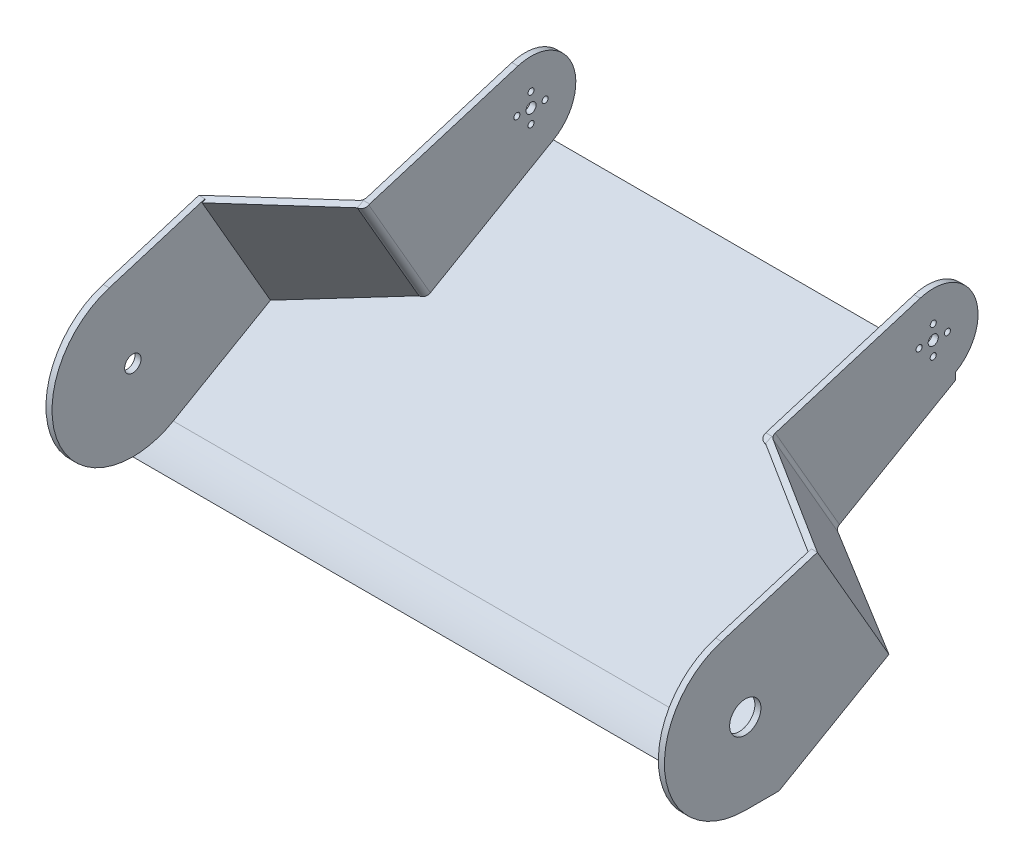
from build123d import *

# Parameters (mm, degrees)
SKETCH_2_R          = 3
SKETCH_2_R_2        = 1.5
SKETCH_2_R_3        = 2.5
EXTRUDE_1_DEPTH     = 3
EXTRUDE_2_DEPTH     = 196
SKETCH_5_R          = 8
CUT_EXTRUDE_1_DEPTH = 10
SKETCH_6_R          = 4.05
CUT_EXTRUDE_2_DEPTH = 10
SKETCH_8_R          = 40
EXTRUDE_3_DEPTH     = 3
EXTRUDE_START       = -61
EXTRUDE_4_DEPTH     = 64
EXTRUDE_5_DEPTH     = 3
EXTRUDE_START_2     = -3
EXTRUDE_14_DEPTH    = 3
EXTRUDE_15_DEPTH    = 3
SKETCH_16_R         = 40
EXTRUDE_16_DEPTH    = 3
CUT_EXTRUDE_START   = -20
CUT_EXTRUDE_5_DEPTH = 20
CUT_EXTRUDE_6_DEPTH = 20
CUT_EXTRUDE_7_DEPTH = 3
FILLET_3_R          = 3
FILLET_4_R          = 3
FILLET_5_R          = 3
FILLET_6_R          = 3
SKETCH_22_R         = 7.75
CUT_EXTRUDE_8_DEPTH = 10
SKETCH_23_R         = 4.05
CUT_EXTRUDE_9_DEPTH = 10


# Some blends are built 0.0001 mm under size
with BuildPart() as part:
    # 草图2 → 凸台-拉伸1 (new body)
    with BuildSketch(Plane(origin=(0, 0, 0), x_dir=(0, 0, -1), z_dir=(1, 0, 0))):
        with BuildLine():
            Line((138.514809283, 84.200667909), (-11.70063651, 38.25042621))
            ThreePointArc((-11.70063651, 38.25042621), (-39.560188627, -5.915359313), (0, -40))
            Line((0, -40), (16.710190716, -40))
            Line((16.710190716, -40), (156.071648789, 40.329376559))
            Line((156.071648789, 40.329376559), (156.071648789, 43.792069046))
            ThreePointArc((156.071648789, 43.792069046), (165.334026038, 71.834783727), (138.514809283, 84.200667909))
        make_face()
        Circle(SKETCH_2_R, mode=Mode.SUBTRACT)
        with Locations((145, 70)):
            Circle(SKETCH_2_R_2, mode=Mode.SUBTRACT)
        with Locations((138, 63)):
            Circle(SKETCH_2_R_2, mode=Mode.SUBTRACT)
        with Locations((145, 56)):
            Circle(SKETCH_2_R_2, mode=Mode.SUBTRACT)
        with Locations((145, 63)):
            Circle(SKETCH_2_R_3, mode=Mode.SUBTRACT)
        with Locations((152, 63)):
            Circle(SKETCH_2_R_2, mode=Mode.SUBTRACT)
    extrude_1 = extrude(amount=EXTRUDE_1_DEPTH)

    # 草图4 → 凸台-拉伸2 (add)
    with BuildSketch(Plane(origin=(3, 0, 0), x_dir=(0, 0, -1), z_dir=(1, 0, 0))):
        with BuildLine():
            Line((0, -40), (16.710190716, -40))
            Line((16.710190716, -40), (156.071648789, 40.329376559))
            Line((156.071648789, 40.329376559), (156.071648789, 43.792069046))
            Line((156.071648789, 43.792069046), (19.975563357, -34.655113166))
            ThreePointArc((19.975563357, -34.655113166), (10.339136167, -38.640681455), (0, -40))
        make_face()
    extrude(amount=EXTRUDE_2_DEPTH)

    # 镜向2: 凸台-拉伸1 across plane
    add(extrude_1.mirror(Plane(origin=(101, 0, 0), x_dir=(0, 0, 1), z_dir=(1, 0, 0))))

    # 草图5 → 切除-拉伸1 (cut)
    with BuildSketch(Plane(origin=(202, 0, 0), x_dir=(0, 0, -1), z_dir=(1, 0, 0))):
        Circle(SKETCH_5_R)
    extrude(amount=-CUT_EXTRUDE_1_DEPTH, mode=Mode.SUBTRACT)

    # 草图6 → 切除-拉伸2 (cut)
    with BuildSketch(Plane.ZY):
        Circle(SKETCH_6_R)
    extrude(amount=-CUT_EXTRUDE_2_DEPTH, mode=Mode.SUBTRACT)

    # 草图9 → 凸台-拉伸4 (add)
    with BuildSketch(Plane(origin=(251, 0, 0), x_dir=(0, 0, -1), z_dir=(1, 0, 0)).offset(EXTRUDE_START)):
        with BuildLine():
            Line((0, -40), (16.710190716, -40))
            Line((16.710190716, -40), (53.747942483, -18.651059269))
            Line((53.747942483, -18.651059269), (52.249775231, -16.051925781))
            Line((52.249775231, -16.051925781), (19.975563357, -34.655113166))
            ThreePointArc((19.975563357, -34.655113166), (10.339136167, -38.640681455), (0, -40))
        make_face()
    extrude_4 = extrude(amount=EXTRUDE_4_DEPTH)

    # 草图10 → 凸台-拉伸5 (add)
    with BuildSketch(Plane(origin=(0, -37.254246654, -21.473730609), x_dir=(1, 0, 0), z_dir=(0, -0.8663778291595938, -0.49938908392225567))):
        Polygon((254, -37.251890328), (254, -57.251890328), (202, -87.274104325), (202, -37.251890328), align=None)
    extrude_5 = extrude(amount=-EXTRUDE_5_DEPTH)



with BuildPart() as body_2:
    # 草图8 → 凸台-拉伸3 (new body)
    with BuildSketch(Plane(origin=(251, 0, 0), x_dir=(0, 0, -1), z_dir=(1, 0, 0))):
        Circle(SKETCH_8_R)
    extrude(amount=EXTRUDE_3_DEPTH)


with BuildPart() as part_1:
    add(part.part)

    add(body_2.part)  # 凸台-拉伸14 merges body 2
    # 草图14 → 凸台-拉伸14 (add)
    with BuildSketch(Plane(origin=(254, 0, 0), x_dir=(0, 0, -1), z_dir=(1, 0, 0)).offset(EXTRUDE_START_2)):
        with BuildLine():
            Line((-11.70063651, 38.25042621), (35.679778873, 52.743886101))
            Line((35.679778873, 52.743886101), (69.577331814, -6.064144103))
            Line((69.577331814, -6.064144103), (19.975563357, -34.655113166))
            ThreePointArc((19.975563357, -34.655113166), (36.686823541, 15.939792297), (-11.70063651, 38.25042621))
        make_face()
    extrude_14 = extrude(amount=EXTRUDE_14_DEPTH)

    # 草图15 → 凸台-拉伸15 (add)
    with BuildSketch(Plane(origin=(88.290795719, 76.368648195, -132.490087928), x_dir=(-0.8660254037844362, 0.24969454196113003, -0.4331889145798008), z_dir=(0.5000000000000044, 0.4324836330493111, -0.7503052093278204))):
        Polygon((-191.344507397, -43), (-191.344507397, 27.878041456), (-131.300079402, 20.97393325), (-131.300079402, -43), align=None)
    extrude_15 = extrude(amount=-EXTRUDE_15_DEPTH)

    # 镜向8: 凸台-拉伸15 across plane
    add(extrude_15.mirror(Plane(origin=(101, 0, 0), x_dir=(0, 0, 1), z_dir=(1, 0, 0))))

    # 镜向10: 凸台-拉伸5 across plane
    add(extrude_5.mirror(Plane(origin=(101, 0, 0), x_dir=(0, 0, 1), z_dir=(1, 0, 0))))

    # 镜向11: 凸台-拉伸4 across plane
    add(extrude_4.mirror(Plane(origin=(101, 0, 0), x_dir=(0, 0, 1), z_dir=(1, 0, 0))))

    # 镜向12: 凸台-拉伸14 across plane
    add(extrude_14.mirror(Plane(origin=(101, 0, 0), x_dir=(0, 0, 1), z_dir=(1, 0, 0))))

    # 草图16 → 凸台-拉伸16 (add)
    with BuildSketch(Plane.ZY.offset(52)):
        Circle(SKETCH_16_R)
    extrude(amount=-EXTRUDE_16_DEPTH)

    # 草图17 → 切除-拉伸5 (cut)
    with BuildSketch(Plane(origin=(202, 0, 0), x_dir=(0, 0, -1), z_dir=(1, 0, 0)).offset(CUT_EXTRUDE_START)):
        with BuildLine():
            Line((-11.120326036, 38.423148607), (61.739147636, 60.715331959))
            Line((61.739147636, 60.715331959), (65.138195736, 61.755085767))
            Line((65.138195736, 61.755085767), (62.037518083, 60.197696416))
            Line((62.037518083, 60.197696416), (92.586691567, 7.198687311))
            Line((92.586691567, 7.198687311), (19.975563357, -34.655113166))
            ThreePointArc((19.975563357, -34.655113166), (-36.806411031, -15.66167638), (-11.120326036, 38.423148607))
        make_face()
    extrude(amount=CUT_EXTRUDE_5_DEPTH, mode=Mode.SUBTRACT)


with BuildPart() as cut_extrude_5_piece_1:
    # of the separate pieces the step leaves, piece 1, a body of its own (cut_extrude_5_pieces)
    add(part_1.part.solids().sort_by_distance((0, 43.792069046, -156.071648789))[0])

    # 草图21 → 切除-拉伸7 (cut)
    with BuildSketch(Plane(origin=(3, 0, 0), x_dir=(0, 0, -1), z_dir=(1, 0, 0))):
        with BuildLine():
            Line((92.586691567, 7.198687311), (62.037518083, 60.197696416))
            Line((62.037518083, 60.197696416), (65.138195736, 61.755085767))
            Line((65.138195736, 61.755085767), (61.739147636, 60.715331959))
            Line((61.739147636, 60.715331959), (-11.70063651, 38.25042621))
            ThreePointArc((-11.70063651, 38.25042621), (-36.686823541, -15.939792297), (19.975563357, -34.655113166))
            Line((19.975563357, -34.655113166), (92.586691567, 7.198687311))
        make_face()
    extrude(amount=-CUT_EXTRUDE_7_DEPTH, mode=Mode.SUBTRACT)

    # 圆角3
    fillet_3_edges = [cut_extrude_5_piece_1.edges().sort_by_distance(p)[0] for p in [
        (3, 33.698191863, -77.312104825),
    ]]
    fillet(fillet_3_edges, radius=FILLET_3_R - 0.0001)  # a hair under: the kernel refuses the full size

    # 圆角4
    fillet_4_edges = [cut_extrude_5_piece_1.edges().sort_by_distance(p)[0] for p in [
        (199, 33.698191863, -77.312104825),
    ]]
    fillet(fillet_4_edges, radius=FILLET_4_R - 0.0001)  # a hair under: the kernel refuses the full size

    # 圆角5
    # the kernel refuses this fillet: 3 mm, written as the material it adds along each edge
    with BuildSketch(Plane(origin=(202, 65.506611814, -62.97577757), x_dir=(0, 0.49938908392225534, -0.8663778291595939), z_dir=(0, -0.866377829159594, -0.4993890839222554))) as fillet_5_piece_1_section:
        with BuildLine():
            CenterArc((FILLET_5_R * 0.57735026919, FILLET_5_R), FILLET_5_R, 210, 60)
            Line((-FILLET_5_R * 0.288675134595, FILLET_5_R * 0.5), (0, 0))
            Line((0, 0), (FILLET_5_R * 0.57735026919, 0))
        make_face()
    fillet_5_piece_1 = extrude(amount=68.304060269, mode=Mode.PRIVATE)
    fillet_5_piece_1 = split(fillet_5_piece_1, bisect_by=Plane(origin=(202.325553984, 63.906694987, -72.171998522), z_dir=(0, -0.9562606552534866, -0.2925159127537726)), keep=Keep.TOP, mode=Mode.PRIVATE)
    fillet_5_piece_1 = split(fillet_5_piece_1, bisect_by=Plane(origin=(199.177617764, 62.412552566, -67.072312804), z_dir=(0.09892666816624712, -0.8892295154916122, -0.44663674625368427)), keep=Keep.TOP, mode=Mode.PRIVATE)
    add(fillet_5_piece_1)

    # 圆角6
    # the kernel refuses this fillet: 3 mm, written as the material it adds along each edge
    with BuildSketch(Plane(origin=(0, 6.329488355, -97.086079656), x_dir=(2.017234182721707e-14, 0.49938908392225534, -0.8663778291595939), z_dir=(0, 0.8663778291595939, 0.4993890839222554))) as fillet_6_piece_1_section:
        with BuildLine():
            CenterArc((FILLET_6_R * 0.57735026919, FILLET_6_R), FILLET_6_R, 210, 60)
            Line((-FILLET_6_R * 0.288675134595, FILLET_6_R * 0.5), (0, 0))
            Line((0, 0), (FILLET_6_R * 0.57735026919, 0))
        make_face()
    fillet_6_piece_1 = extrude(amount=68.304060269, mode=Mode.PRIVATE)
    fillet_6_piece_1 = split(fillet_6_piece_1, bisect_by=Plane(origin=(-0.325553984, 63.906694987, -72.171998522), z_dir=(0, -0.9562606552534866, -0.2925159127537726)), keep=Keep.TOP, mode=Mode.PRIVATE)
    fillet_6_piece_1 = split(fillet_6_piece_1, bisect_by=Plane(origin=(2.822382236, 62.412552566, -67.072312804), z_dir=(-0.09892666816624712, -0.8892295154916122, -0.44663674625368427)), keep=Keep.TOP, mode=Mode.PRIVATE)
    add(fillet_6_piece_1)

    # 草图22 → 切除-拉伸8 (cut)
    with BuildSketch(Plane(origin=(254, 0, 0), x_dir=(0, 0, -1), z_dir=(1, 0, 0))):
        Circle(SKETCH_22_R)
    extrude(amount=-CUT_EXTRUDE_8_DEPTH, mode=Mode.SUBTRACT)

    # 草图23 → 切除-拉伸9 (cut)
    with BuildSketch(Plane.ZY.offset(52)):
        Circle(SKETCH_23_R)
    extrude(amount=-CUT_EXTRUDE_9_DEPTH, mode=Mode.SUBTRACT)


with BuildPart() as cut_extrude_5_piece_2:
    # of the separate pieces the step leaves, piece 2, a body of its own (cut_extrude_5_pieces)
    add(part_1.part.solids().sort_by_distance((202, 60.715331959, -61.739147636))[0])

    # 草图18 → 切除-拉伸6 (cut)
    with BuildSketch(Plane(origin=(0, 38.25042621, 11.70063651), x_dir=(1, 0, 0), z_dir=(0, 0.9562606552534866, 0.2925159127537726))):
        Polygon((199, 76.798918519), (202, 76.932821805), (202, 0), (199, 0), align=None)
    extrude(amount=-CUT_EXTRUDE_6_DEPTH, mode=Mode.SUBTRACT)


solid = cut_extrude_5_piece_1.part
